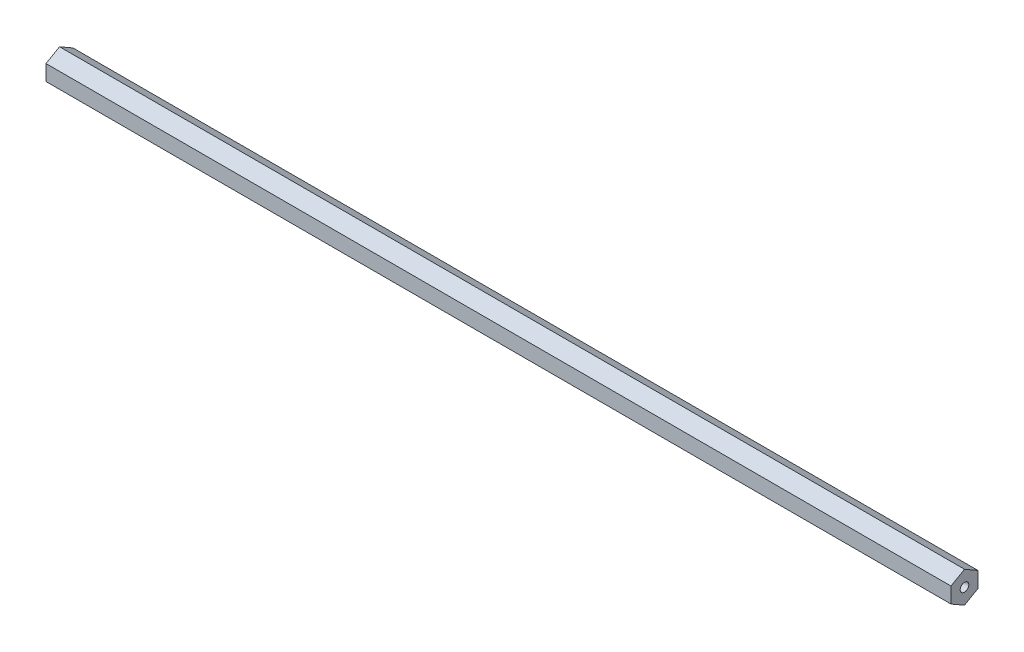
from build123d import *

# Parameters (mm, degrees)
BOSS_EXTRUDE1_DEPTH                  = 212.725
F_10_32_TAPPED_HOLE1_D               = 4.0386
F_10_32_TAPPED_HOLE1_DEPTH           = 16.34744
F_10_32_TAPPED_HOLE1_TIP             = 1.213317848
F_10_32_TAPPED_HOLE1_ON_FACE_2_D     = 4.0386
F_10_32_TAPPED_HOLE1_ON_FACE_2_DEPTH = 16.34744
F_10_32_TAPPED_HOLE1_ON_FACE_2_TIP   = 1.213317848


with BuildPart() as part:
    # Sketch1 → Boss-Extrude1 (new, symmetric)
    with BuildSketch(Plane(origin=(0, 0, 0), x_dir=(0, 0, -1), z_dir=(1, 0, 0))):
        Polygon((6.35, 3.666174209), (0, 7.332348419), (-6.35, 3.666174209), (-6.35, -3.666174209), (0, -7.332348419), (6.35, -3.666174209), align=None)
    extrude(amount=BOSS_EXTRUDE1_DEPTH, both=True)

    # #10-32 Tapped Hole1
    with Locations(Plane(origin=(212.725, 0, 0), x_dir=(0, 0, 1), z_dir=(1, 0, 0))):
        with Locations((0, 0)):
            Hole(F_10_32_TAPPED_HOLE1_D / 2, depth=F_10_32_TAPPED_HOLE1_DEPTH)
            with Locations((0, 0, -(F_10_32_TAPPED_HOLE1_DEPTH + F_10_32_TAPPED_HOLE1_TIP / 2))):  # 118° drill point
                Cone(0, F_10_32_TAPPED_HOLE1_D / 2, F_10_32_TAPPED_HOLE1_TIP, mode=Mode.SUBTRACT)

    # #10-32 Tapped Hole1 on face 2
    with Locations(Plane(origin=(-212.725, 0, 0), x_dir=(0, 0, -1), z_dir=(-1, 0, 0))):
        with Locations((0, 0)):
            Hole(F_10_32_TAPPED_HOLE1_ON_FACE_2_D / 2, depth=F_10_32_TAPPED_HOLE1_ON_FACE_2_DEPTH)
            with Locations((0, 0, -(F_10_32_TAPPED_HOLE1_ON_FACE_2_DEPTH + F_10_32_TAPPED_HOLE1_ON_FACE_2_TIP / 2))):  # 118° drill point
                Cone(0, F_10_32_TAPPED_HOLE1_ON_FACE_2_D / 2, F_10_32_TAPPED_HOLE1_ON_FACE_2_TIP, mode=Mode.SUBTRACT)


solid = part.part
